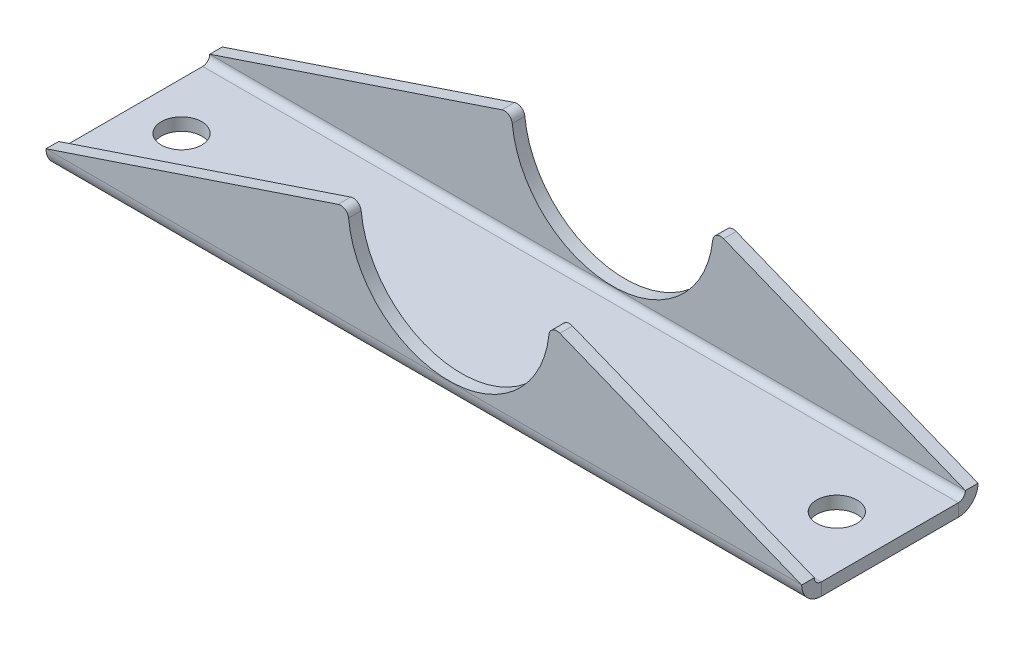
from build123d import *

# Parameters (mm, degrees)
SKETCH1_W                      = 95.25
SKETCH1_H                      = 19.05
BASE_FLANGE1_DEPTH             = 1.5875
EDGE_FLANGE1_STRIP_W           = 8.128
EDGE_FLANGE1_STRIP_H           = 1.5875
EDGE_FLANGE1_STRIP_CUT_DEPTH   = 95.25
EDGE_FLANGE1_STRIP_2_W         = 8.128
EDGE_FLANGE1_STRIP_2_H         = 1.5875
EDGE_FLANGE1_STRIP_CUT_2_DEPTH = 95.25
EDGE_FLANGE1_DEPTH             = 95.25
EDGE_FLANGE1_BEND_DEPTH        = 95.25
CUT_EXTRUDE1_DEPTH             = 55.299926393
CUT_EXTRUDE1_DEPTH_BACK        = 55.299926393
HOLE1_START                    = -1.5875
HOLE1_OUTLINE_R                = 2.5527
HOLE1_DEPTH                    = 1.5875
FILLET1_R                      = 1


# Read off the part's stored shape, not the designer's step: Hole1
# Sheet-metal steps are written as plain solids
with BuildPart() as part:
    # Sketch1 → Base-Flange1 (new body)
    with BuildSketch(Plane(origin=(0, 0, 0), x_dir=(1, 0, 0), z_dir=(0, 1, 0))):
        Rectangle(SKETCH1_W, SKETCH1_H)
    extrude(amount=-BASE_FLANGE1_DEPTH)

    # Edge-Flange1 strip (across the edge) → Edge-Flange1 strip cut (cut)
    with BuildSketch(Plane(origin=(-47.625, 0, 9.525), x_dir=(0, 0, -1), z_dir=(1, 0, 0))):
        with Locations((-3.175, -0.79375)):
            Rectangle(EDGE_FLANGE1_STRIP_W, EDGE_FLANGE1_STRIP_H)
    extrude(amount=EDGE_FLANGE1_STRIP_CUT_DEPTH, mode=Mode.SUBTRACT)

    # Edge-Flange1 strip 2 (across the edge) → Edge-Flange1 strip cut 2 (cut)
    with BuildSketch(Plane(origin=(47.625, 0, -9.525), x_dir=(0, 0, 1), z_dir=(-1, 0, 0))):
        with Locations((-3.175, -0.79375)):
            Rectangle(EDGE_FLANGE1_STRIP_2_W, EDGE_FLANGE1_STRIP_2_H)
    extrude(amount=EDGE_FLANGE1_STRIP_CUT_2_DEPTH, mode=Mode.SUBTRACT)

    # Edge-Flange1 section (across the edge) → Edge-Flange1 (add)
    with BuildSketch(Plane(origin=(-47.625, 0, 9.525), x_dir=(0, 0, -1), z_dir=(1, 0, 0))):
        with BuildLine():
            Line((-1.5875, 0.889), (-1.5875, 13.6525))
            Line((-1.5875, 13.6525), (0, 13.6525))
            Line((0, 13.6525), (0, 0.889))
            ThreePointArc((0, 0.889), (0.260382072, 0.260382072), (0.889, 0))
            Line((0.889, 0), (0.889, -1.5875))
            ThreePointArc((0.889, -1.5875), (-0.862149944, -0.862149944), (-1.5875, 0.889))
        make_face()
    extrude(amount=EDGE_FLANGE1_DEPTH)

    # Edge-Flange1 section 2 (across the edge) → Edge-Flange1 bend (add)
    with BuildSketch(Plane(origin=(47.625, 0, -9.525), x_dir=(0, 0, 1), z_dir=(-1, 0, 0))):
        with BuildLine():
            Line((-1.5875, 0.889), (-1.5875, 13.6525))
            Line((-1.5875, 13.6525), (0, 13.6525))
            Line((0, 13.6525), (0, 0.889))
            ThreePointArc((0, 0.889), (0.260382072, 0.260382072), (0.889, 0))
            Line((0.889, 0), (0.889, -1.5875))
            ThreePointArc((0.889, -1.5875), (-0.862149944, -0.862149944), (-1.5875, 0.889))
        make_face()
    extrude(amount=EDGE_FLANGE1_BEND_DEPTH)

    # Sketch12 → Cut-Extrude1 (cut, two sides: drawn at the far end of the back side and taken through both)
    with BuildSketch(Plane.XY.offset(11.1125).offset(-CUT_EXTRUDE1_DEPTH_BACK)):
        with BuildLine():
            Line((15.847398271, 13.6525), (-9.552601729, 13.6525))
            ThreePointArc((-9.552601729, 13.6525), (3.147398271, 0.9525), (15.847398271, 13.6525))
        make_face()
        Polygon((-47.625, 0.889), (-9.552601729, 13.6525), (-47.625, 13.6525), align=None)
        Polygon((47.625, 13.6525), (15.847398271, 13.6525), (47.625, 0.889), align=None)
    extrude(amount=CUT_EXTRUDE1_DEPTH + CUT_EXTRUDE1_DEPTH_BACK, mode=Mode.SUBTRACT)

    # Hole1 outline → Hole1 (cut)
    with BuildSketch(Plane(origin=(0, 0, 0), x_dir=(1, 0, 0), z_dir=(0, 1, 0)).offset(HOLE1_START)):
        with Locations((40.940976195, 0)):
            Circle(HOLE1_OUTLINE_R)
        with Locations((-41.656, 0)):
            Circle(HOLE1_OUTLINE_R)
    extrude(amount=HOLE1_DEPTH, mode=Mode.SUBTRACT)

    # Fillet1
    fillet1_edges = [part.edges().sort_by_distance(p)[0] for p in [
        (-9.552601729, 13.6525, -10.31875),
        (15.847398271, 13.6525, 10.31875),
        (15.847398271, 13.6525, -10.31875),
        (-9.552601729, 13.6525, 10.31875),
    ]]
    fillet(fillet1_edges, radius=FILLET1_R)


solid = part.part
